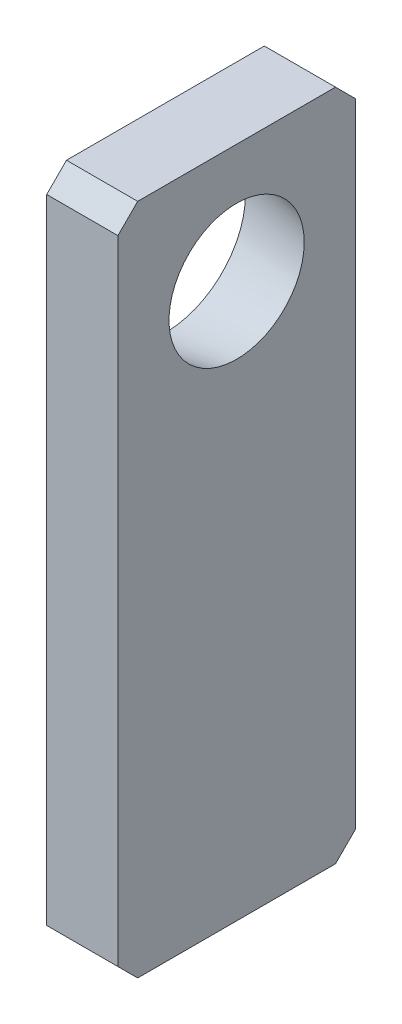
from build123d import *

# Parameters (mm, degrees)
SKETCH1_W                               = 15
SKETCH1_H                               = 37.5
BOSS_EXTRUDE1_DEPTH                     = 4.5
SKETCH2_R                               = 5
CUT_EXTRUDE1_DEPTH                      = 5
CUT_EXTRUDE1_TAPER                      = 10
CUT_EXTRUDE1_OTHER_WAY_DEPTH            = 39.568121551
OFFSET_TO_ACCOUNT_FOR_BASE_THICKNESS_BY = 5
CHAMFER1_SIZE                           = 1.25


# Read off the part's stored shape, not the designer's step: Offset for 3D print
with BuildPart() as part:
    # Sketch1 → Boss-Extrude1 (new body)
    with BuildSketch(Plane(origin=(0, 0, 0), x_dir=(0, 0, -1), z_dir=(1, 0, 0))):
        with Locations((0, 18.75)):
            Rectangle(SKETCH1_W, SKETCH1_H)
    extrude(amount=-BOSS_EXTRUDE1_DEPTH)

    # Sketch2 → Cut-Extrude1 (cut)
    with BuildSketch(Plane(origin=(-5, 0, 0), x_dir=(0, 0, -1), z_dir=(1, 0, 0))):
        with Locations((0, 30)):
            Circle(SKETCH2_R)
    extrude(amount=CUT_EXTRUDE1_DEPTH, taper=CUT_EXTRUDE1_TAPER, mode=Mode.SUBTRACT)

    # Sketch2 → Cut-Extrude1 other way (cut)
    with BuildSketch(Plane(origin=(-5, 0, 0), x_dir=(0, 0, -1), z_dir=(1, 0, 0))):
        with Locations((0, 30)):
            Circle(SKETCH2_R)
    extrude(amount=-CUT_EXTRUDE1_OTHER_WAY_DEPTH, mode=Mode.SUBTRACT)

    # Offset to account for Base Thickness: a face moved outward by 5.0
    extrude(part.faces().sort_by_distance((-2.25, 0, 0))[0], amount=OFFSET_TO_ACCOUNT_FOR_BASE_THICKNESS_BY, dir=(0, -1, 0))

    # Chamfer1
    chamfer1_edges = [part.edges().sort_by_distance(p)[0] for p in [
        (-2.25, -5, -7.5),
        (-2.25, -5, 7.5),
        (-2.25, 37.5, 7.5),
        (-2.25, 37.5, -7.5),
    ]]
    chamfer(chamfer1_edges, length=CHAMFER1_SIZE)

    # Offset for 3D print outline → Offset for 3D print (revolve, cut)
    with BuildSketch(Plane(origin=(0, 30, 0), x_dir=(0, 1, 0), z_dir=(0, 0, -1))):
        Polygon((4.118365096, 0), (4.91183651, -4.5), (5.064150501, -4.5), (4.270679088, 0), align=None)
    revolve(axis=Axis((0, 30, 0), (1, 0, 0)), mode=Mode.SUBTRACT)


solid = part.part
